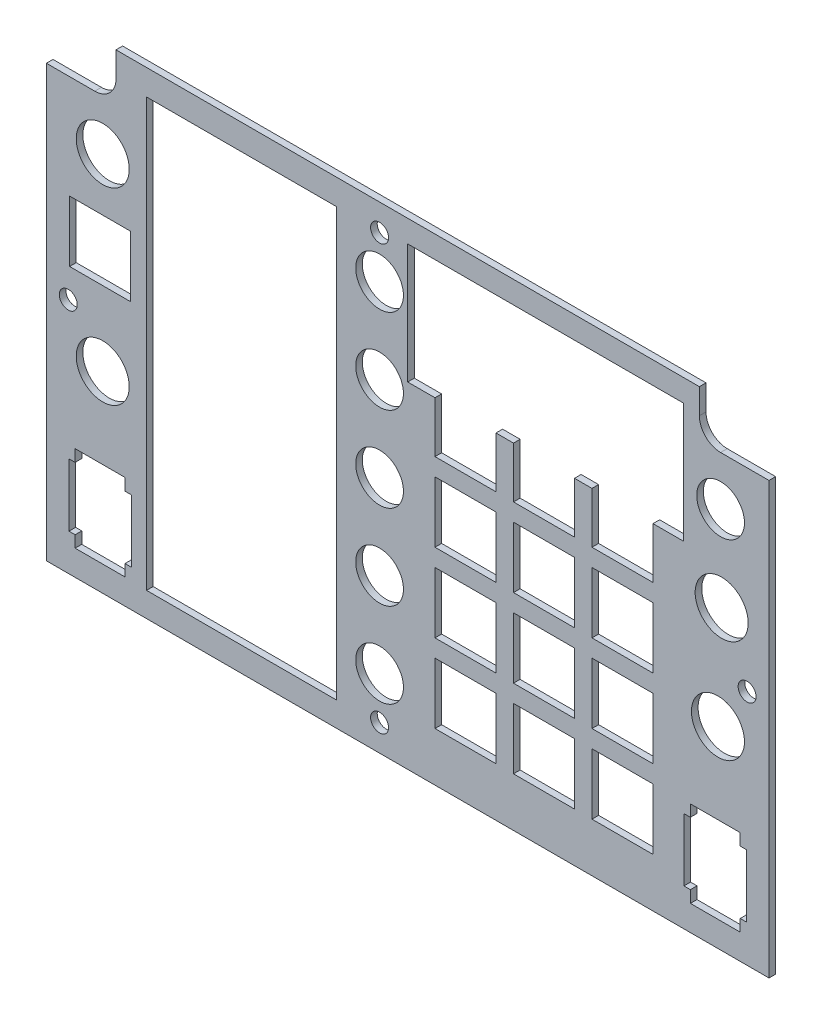
from build123d import *

# Parameters (mm, degrees)
BOSS_EXTRUDE1_DEPTH   = 1.5875
SKETCH2_R             = 6.35
SKETCH2_R_2           = 5.715
SKETCH2_W             = 14.605
SKETCH2_H             = 14.605
SKETCH2_W_2           = 45.462
SKETCH2_H_2           = 102.32
CUT_EXTRUDE1_DEPTH    = 202.151445736
F_6_CLEARANCE_HOLE2_D = 4.3053


with BuildPart() as part:
    # Sketch1 → Boss-Extrude1 (new body)
    with BuildSketch(Plane.XY):
        with BuildLine():
            Line((58.206752076, 169.534029068), (58.206752076, 175.566529068))
            Line((58.206752076, 175.566529068), (-81.493247924, 175.566529068))
            Line((-81.493247924, 175.566529068), (-81.493247924, 169.534029068))
            ThreePointArc((-81.493247924, 169.534029068), (-82.981145475, 165.941926619), (-86.573247924, 164.454029068))
            Line((-86.573247924, 164.454029068), (-98.161997924, 164.454029068))
            Line((-98.161997924, 164.454029068), (-98.161997924, 61.266529068))
            Line((-98.161997924, 61.266529068), (74.875502076, 61.266529068))
            Line((74.875502076, 61.266529068), (74.875502076, 164.454029068))
            Line((74.875502076, 164.454029068), (63.286752076, 164.454029068))
            ThreePointArc((63.286752076, 164.454029068), (59.694649628, 165.941926619), (58.206752076, 169.534029068))
        make_face()
    extrude(amount=BOSS_EXTRUDE1_DEPTH)

    # Sketch2 → Cut-Extrude1 (cut, through all)
    with BuildSketch(Plane.XY.offset(1.5875)):
        with Locations((-84.668247924, 152.389029068)):
            Circle(SKETCH2_R)
        with Locations((-84.668247924, 107.304029068)):
            Circle(SKETCH2_R)
        with Locations((63.540752076, 132.386529068)):
            Circle(SKETCH2_R)
        with Locations((62.651752076, 107.304029068)):
            Circle(SKETCH2_R)
        with Locations((-18.374247924, 77.776529068)):
            Circle(SKETCH2_R_2)
        with Locations((-18.374247924, 98.096529068)):
            Circle(SKETCH2_R_2)
        with Locations((-18.374247924, 118.416529068)):
            Circle(SKETCH2_R_2)
        with Locations((-18.374247924, 138.736529068)):
            Circle(SKETCH2_R_2)
        with Locations((-18.374247924, 159.056529068)):
            Circle(SKETCH2_R_2)
        with Locations((63.286752076, 152.706529068)):
            Circle(SKETCH2_R_2)
        Polygon((67.986752076, 85.173806769), (67.986752076, 87.969529068), (56.046752076, 87.969529068), (56.046752076, 85.173806769), (54.504967043, 85.173806769), (54.504967043, 70.173806769), (56.046752076, 70.173806769), (56.046752076, 67.329529068), (67.986752076, 67.329529068), (67.986752076, 70.173806769), (69.504967043, 70.173806769), (69.504967043, 85.173806769), align=None)
        with Locations((39.791752076, 80.316529068)):
            Rectangle(SKETCH2_W, SKETCH2_H)
        with Locations((39.791752076, 99.112529068)):
            Rectangle(SKETCH2_W, SKETCH2_H)
        with Locations((39.791752076, 117.908529068)):
            Rectangle(SKETCH2_W, SKETCH2_H)
        with Locations((20.995752076, 80.316529068)):
            Rectangle(SKETCH2_W, SKETCH2_H)
        Polygon((32.489252076, 141.609529068), (32.489252076, 129.402029068), (47.094252076, 129.402029068), (47.094252076, 141.609529068), (54.396752076, 141.609529068), (54.396752076, 170.249529068), (-11.643247924, 170.249529068), (-11.643247924, 141.609529068), (-5.102747924, 141.609529068), (-5.102747924, 129.402029068), (9.502252076, 129.402029068), (9.502252076, 141.609529068), (13.693252076, 141.609529068), (13.693252076, 129.402029068), (28.298252076, 129.402029068), (28.298252076, 141.609529068), align=None)
        with Locations((20.995752076, 99.112529068)):
            Rectangle(SKETCH2_W, SKETCH2_H)
        with Locations((20.995752076, 117.908529068)):
            Rectangle(SKETCH2_W, SKETCH2_H)
        with Locations((2.199752076, 117.908529068)):
            Rectangle(SKETCH2_W, SKETCH2_H)
        with Locations((2.199752076, 99.112529068)):
            Rectangle(SKETCH2_W, SKETCH2_H)
        with Locations((2.199752076, 80.316529068)):
            Rectangle(SKETCH2_W, SKETCH2_H)
        with Locations((-85.303247924, 132.386529068)):
            Rectangle(SKETCH2_W, SKETCH2_H)
        with Locations((-51.442247924, 118.289529068)):
            Rectangle(SKETCH2_W_2, SKETCH2_H_2)
        Polygon((-79.333247924, 85.116484212), (-79.333247924, 87.969529068), (-91.273247924, 87.969529068), (-91.273247924, 85.116484212), (-92.755785181, 85.116484212), (-92.755785181, 70.116484212), (-91.273247924, 70.116484212), (-91.273247924, 67.329529068), (-79.333247924, 67.329529068), (-79.333247924, 70.116484212), (-77.755785181, 70.116484212), (-77.755785181, 85.116484212), align=None)
    extrude(amount=-CUT_EXTRUDE1_DEPTH, mode=Mode.SUBTRACT)

    # #6 Clearance Hole2 (through all)
    with Locations(Plane(origin=(-11.643247924, -6.662700632, -3.175), x_dir=(-1, 0, 0), z_dir=(0, 0, -1))):
        with Locations((-81.28, 124.6982297), (6.731, 175.8792297), (81.28, 124.6982297), (6.731, 74.2792297)):
            Hole(F_6_CLEARANCE_HOLE2_D / 2)


solid = part.part
